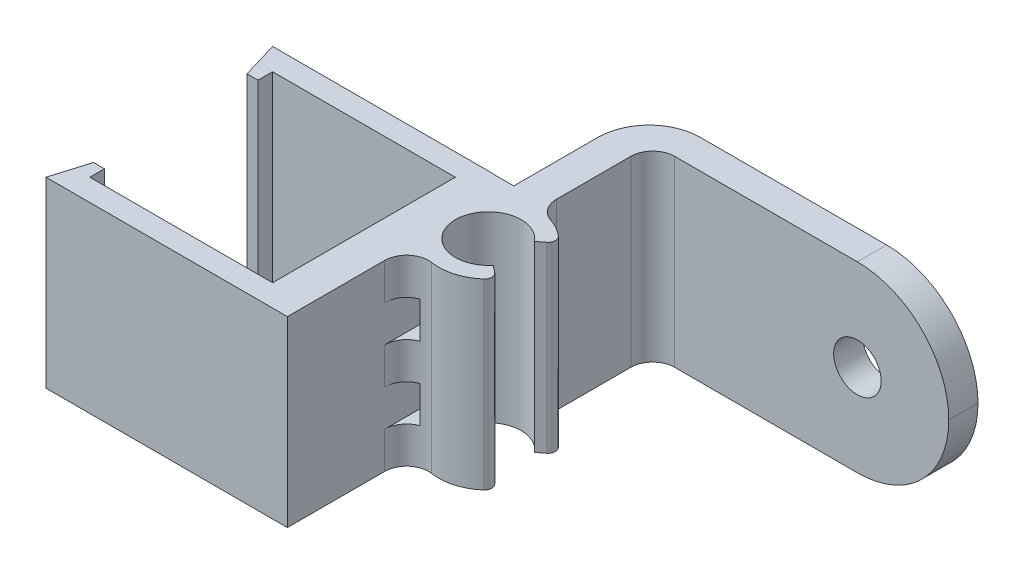
from build123d import *

# Parameters (mm, degrees)
EXTRUDE_1_DEPTH      = 25
CUT_EXTRUDE_4_DEPTH  = 80.457942189
SKETCH_7_W           = 16.60831278
SKETCH_7_H           = 38.473598513
CUT_EXTRUDE_14_DEPTH = 80.457942189
SKETCH_8_W           = 5
SKETCH_8_H           = 30.968526609
EXTRUDE_2_DEPTH      = 25
EXTRUDE_3_DEPTH      = 25
FILLET_4_R           = 1
SKETCH_10_W          = 10.885979968
SKETCH_10_H          = 16.094938527
CUT_EXTRUDE_15_DEPTH = 80.457942189
SKETCH_11_W          = 4.5
SKETCH_11_H          = 22
EXTRUDE_5_DEPTH      = 25
SKETCH_14_W          = 45
SKETCH_14_H          = 4
EXTRUDE_6_DEPTH      = 25
SKETCH_15_R          = 3.25
CUT_EXTRUDE_19_DEPTH = 10
FILLET_5_R           = 12.5
FILLET_6_R           = 3
FILLET_7_R           = 7
FILLET_8_R           = 3
SKETCH_17_W          = 2
SKETCH_17_H          = 5
CUT_EXTRUDE_21_DEPTH = 23


with BuildPart() as part:
    # Эскиз1 → Бобышка-Вытянуть1 (new body)
    with BuildSketch(Plane(origin=(0, 0, 0), x_dir=(1, 0, 0), z_dir=(0, 1, 0))):
        Polygon((-66.825757576, 34.969739794), (-66.825757576, 29.969739794), (-63.825757576, 29.969739794), (-63.825757576, 31.969739794), (-38.825757576, 31.969739794), (-38.825757576, 6.969739794), (-63.825757576, 6.969739794), (-63.825757576, 8.969739794), (-66.825757576, 8.969739794), (-66.825757576, 3.969739794), (-22.123470102, 3.969739794), (-36.579007505, 34.969739794), align=None)
    extrude(amount=EXTRUDE_1_DEPTH)

    # Эскиз3 → Вырез-Вытянуть4 (cut, through all)
    with BuildSketch(Plane.XZ):
        Polygon((-66.825757576, -3.969739794), (-65.325757576, -8.969739794), (-66.825757576, -8.969739794), align=None)
        Polygon((-66.825757576, -29.969739794), (-66.825757576, -34.969739794), (-65.325757576, -29.969739794), align=None)
    extrude(amount=-CUT_EXTRUDE_4_DEPTH, mode=Mode.SUBTRACT)

    # Эскиз7 → Вырез-Вытянуть14 (cut, through all)
    with BuildSketch(Plane(origin=(0, 0, 0), x_dir=(-1, 0, 0), z_dir=(0, -1, 0))):
        with Locations((27.703474463, 20.539743139)):
            Rectangle(SKETCH_7_W, SKETCH_7_H)
    extrude(amount=-CUT_EXTRUDE_14_DEPTH, mode=Mode.SUBTRACT)

    # Эскиз8 → Бобышка-Вытянуть2 (add)
    with BuildSketch(Plane(origin=(0, 0, 0), x_dir=(-1, 0, 0), z_dir=(0, -1, 0))):
        with Locations((36.298943925, 19.454003098)):
            Rectangle(SKETCH_8_W, SKETCH_8_H)
    extrude(amount=-EXTRUDE_2_DEPTH)

    # Эскиз9 → Бобышка-Вытянуть3 (add)
    with BuildSketch(Plane.XZ):
        with BuildLine():
            Line((-25.798943925, -9.121669553), (-24.000865345, -7.695483003))
            ThreePointArc((-24.000865345, -7.695483003), (-36.096342696, -11.954003099), (-24.000865345, -16.212523195))
            Line((-24.000865345, -16.212523195), (-25.798943925, -14.786336644))
            ThreePointArc((-25.798943925, -14.786336644), (-33.80140029, -11.954003099), (-25.798943925, -9.121669553))
        make_face()
        with BuildLine():
            Line((-25.798943925, -24.130682885), (-24.000865345, -22.7126007))
            ThreePointArc((-24.000865345, -22.7126007), (-36.0856317, -26.954003099), (-24.000865345, -31.195405497))
            Line((-24.000865345, -31.195405497), (-25.798943925, -29.777323313))
            ThreePointArc((-25.798943925, -29.777323313), (-33.795735785, -26.954003099), (-25.798943925, -24.130682885))
        make_face()
    extrude(amount=-EXTRUDE_3_DEPTH)

    # Скругление4
    fillet_4_edges = [part.edges().sort_by_distance(p)[0] for p in [
        (-24.000865345, 12.5, -7.695483003),
        (-24.000865345, 12.5, -16.212523195),
        (-24.000865345, 12.5, -22.7126007),
        (-24.000865345, 12.5, -31.195405497),
    ]]
    fillet(fillet_4_edges, radius=FILLET_4_R)

    # Эскиз10 → Вырез-Вытянуть15 (cut, through all)
    with BuildSketch(Plane(origin=(0, 25, 0), x_dir=(1, 0, 0), z_dir=(0, 1, 0))):
        with Locations((-28.355953941, 12.017209058)):
            Rectangle(SKETCH_10_W, SKETCH_10_H)
    extrude(amount=-CUT_EXTRUDE_15_DEPTH, mode=Mode.SUBTRACT)

    # Эскиз11 → Бобышка-Вытянуть5 (add)
    with BuildSketch(Plane(origin=(0, 25, 0), x_dir=(1, 0, 0), z_dir=(0, 1, 0))):
        with Locations((-31.548943925, 42.450794958)):
            Rectangle(SKETCH_11_W, SKETCH_11_H)
    extrude(amount=-EXTRUDE_5_DEPTH)

    # Эскиз14 → Бобышка-Вытянуть6 (add)
    with BuildSketch(Plane(origin=(0, 25, 0), x_dir=(1, 0, 0), z_dir=(0, 1, 0))):
        with Locations((-11.298943925, 51.450794958)):
            Rectangle(SKETCH_14_W, SKETCH_14_H)
    extrude(amount=-EXTRUDE_6_DEPTH)

    # Эскиз15 → Вырез-Вытянуть19 (cut)
    with BuildSketch(Plane(origin=(0, 0, -53.450794958), x_dir=(-1, 0, 0), z_dir=(0, 0, -1))):
        with Locations((1.298943925, 12.5)):
            Circle(SKETCH_15_R)
    extrude(amount=-CUT_EXTRUDE_19_DEPTH, mode=Mode.SUBTRACT)

    # Скругление5
    fillet_5_edges = [part.edges().sort_by_distance(p)[0] for p in [
        (11.201056075, 0, -51.450794958),
        (11.201056075, 25, -51.450794958),
    ]]
    fillet(fillet_5_edges, radius=FILLET_5_R - 0.0001)  # a hair under: the kernel refuses the full size

    # Скругление6
    fillet_6_edges = [part.edges().sort_by_distance(p)[0] for p in [
        (-29.298943925, 12.5, -49.450794958),
    ]]
    fillet(fillet_6_edges, radius=FILLET_6_R)

    # Скругление7
    fillet_7_edges = [part.edges().sort_by_distance(p)[0] for p in [
        (-33.798943925, 12.5, -53.450794958),
    ]]
    fillet(fillet_7_edges, radius=FILLET_7_R)

    # Скругление8
    fillet_8_edges = [part.edges().sort_by_distance(p)[0] for p in [
        (-33.798943925, 12.5, -21.873734311),
        (-29.298943925, 12.5, -33.740690873),
    ]]
    fillet(fillet_8_edges, radius=FILLET_8_R)

    # Эскиз17 → Вырез-Вытянуть21 (cut)
    with BuildSketch(Plane.XY.offset(-3.969739794)):
        with Locations((-32.798943925, 17.5)):
            Rectangle(SKETCH_17_W, SKETCH_17_H)
        with Locations((-32.798943925, 7.5)):
            Rectangle(SKETCH_17_W, SKETCH_17_H)
    extrude(amount=-CUT_EXTRUDE_21_DEPTH, mode=Mode.SUBTRACT)


solid = part.part
